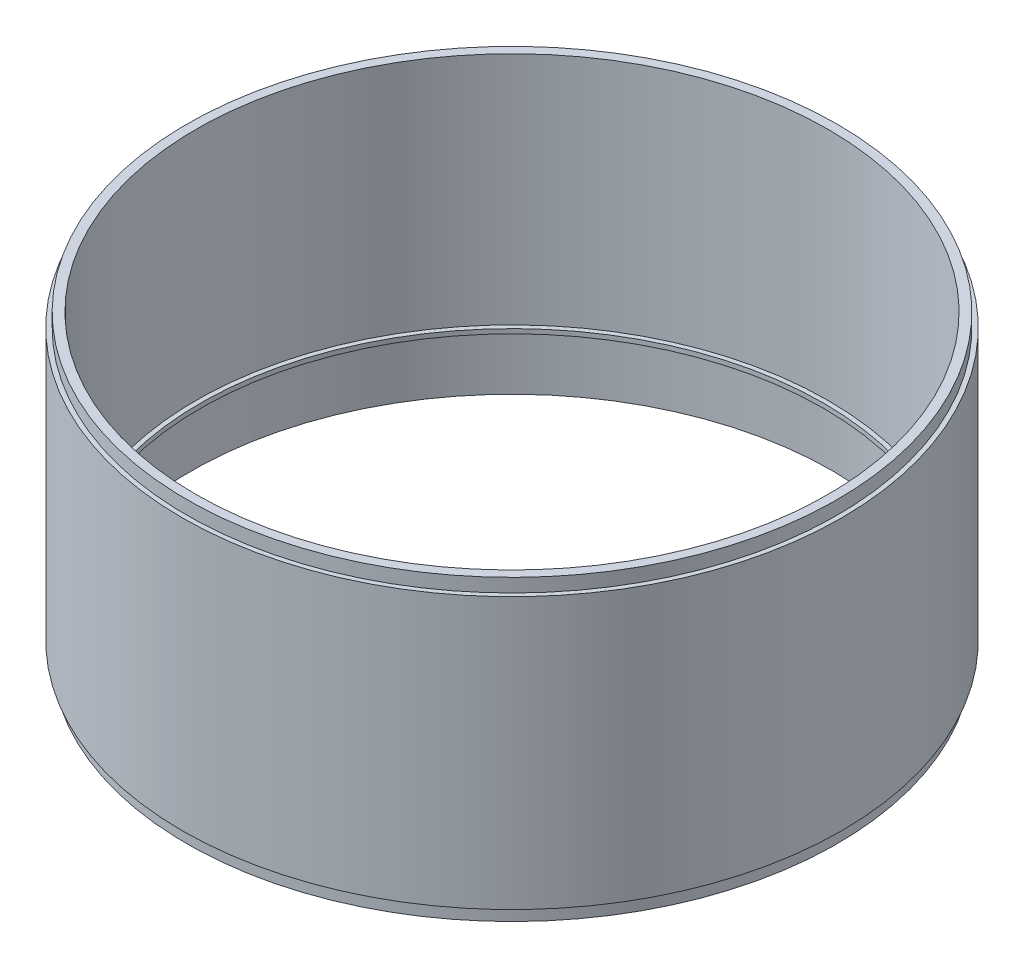
from build123d import *


with BuildPart() as part:
    # Schizzo1 → Rivoluzione1 (revolve)
    with BuildSketch(Plane.XY):
        Polygon((-71, 0), (-71, 13), (-69, 13), (-69, 14), (-70, 14), (-70, 66), (-72, 66), (-72, 63), (-73, 63), (-73, 3), (-72, 3), (-72, 0), align=None)
    revolve(axis=Axis((0, 0, 0), (0, 1, 0)))


solid = part.part
